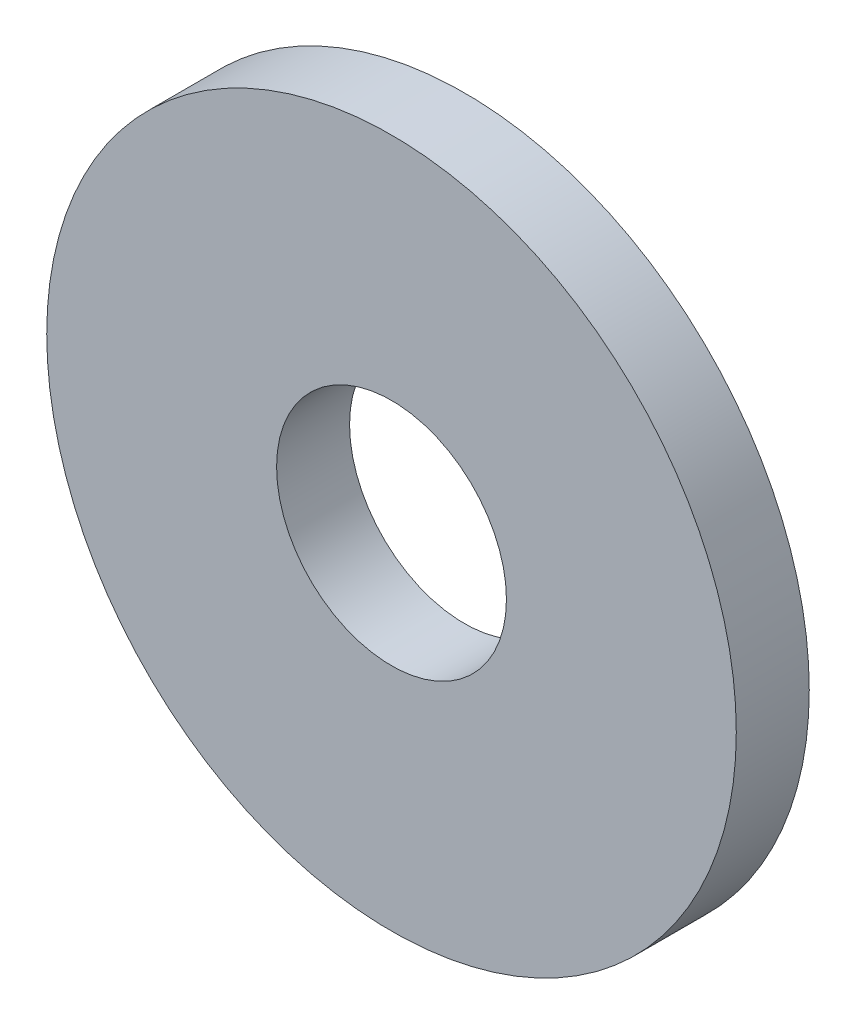
from build123d import *

# Parameters (mm, degrees)
SKETCH1_R           = 6
SKETCH1_R_2         = 2
BOSS_EXTRUDE2_DEPTH = 1.27


with BuildPart() as part:
    # Sketch1 → Boss-Extrude2 (new body)
    with BuildSketch(Plane.XY):
        Circle(SKETCH1_R)
        Circle(SKETCH1_R_2, mode=Mode.SUBTRACT)
    extrude(amount=BOSS_EXTRUDE2_DEPTH)


solid = part.part
